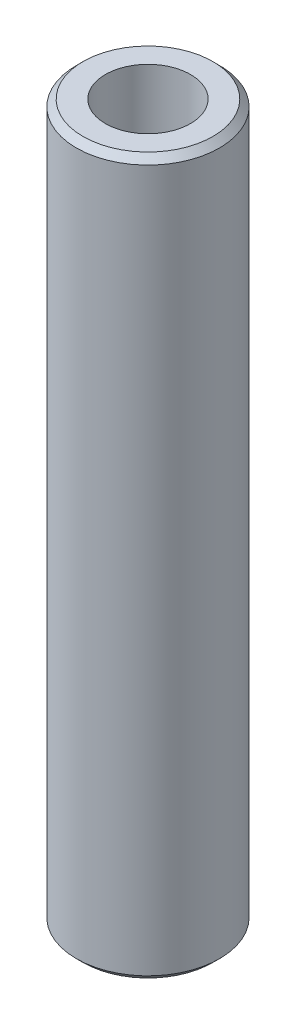
from build123d import *
from OCP.BRepFilletAPI import BRepFilletAPI_MakeChamfer

# Parameters (mm, degrees)
SKETCH1_R           = 60
BOSS_EXTRUDE1_DEPTH = 600
SKETCH2_R           = 35.699151972
CUT_EXTRUDE1_DEPTH  = 606.970296302
CHAMFER1_SIZE       = 5.584052257
CHAMFER1_SIZE2      = 5.527317837


with BuildPart() as part:
    # Sketch1 → Boss-Extrude1 (new body)
    with BuildSketch(Plane(origin=(0, 0, 0), x_dir=(1, 0, 0), z_dir=(0, 1, 0))):
        Circle(SKETCH1_R)
    extrude(amount=BOSS_EXTRUDE1_DEPTH)

    # Sketch2 → Cut-Extrude1 (cut, through all)
    with BuildSketch(Plane(origin=(0, 0, 0), x_dir=(1, 0, 0), z_dir=(0, 1, 0))):
        Circle(SKETCH2_R)
    extrude(amount=CUT_EXTRUDE1_DEPTH, mode=Mode.SUBTRACT)

    # Chamfer1: one chamfer whose edges measure the first distance from different faces: ONE call of the kernel's chamfer builder (chamfer() names one face for all edges)
    chamfer1_edges_1 = [part.edges().sort_by_distance(p)[0] for p in [
        (-60, 600, 0),
    ]]
    chamfer1_side_1 = [part.faces().sort_by_distance(p)[0] for p in [
        (-60, 300, 0),
    ]]
    chamfer1_edges_2 = [part.edges().sort_by_distance(p)[0] for p in [
        (-60, 0, 0),
    ]]
    chamfer1_side_2 = [part.faces().sort_by_distance(p)[0] for p in [
        (-58.302943725, 0, 0),
    ]]
    chamfer1 = BRepFilletAPI_MakeChamfer(part.part.solid().wrapped)
    for e in chamfer1_edges_1:
        chamfer1.Add(CHAMFER1_SIZE, CHAMFER1_SIZE2, e.wrapped, chamfer1_side_1[0].wrapped)  # the first distance lies on this face
    for e in chamfer1_edges_2:
        chamfer1.Add(CHAMFER1_SIZE, CHAMFER1_SIZE2, e.wrapped, chamfer1_side_2[0].wrapped)  # the first distance lies on this face
    add(Compound.cast(chamfer1.Shape()), mode=Mode.REPLACE)


solid = part.part
